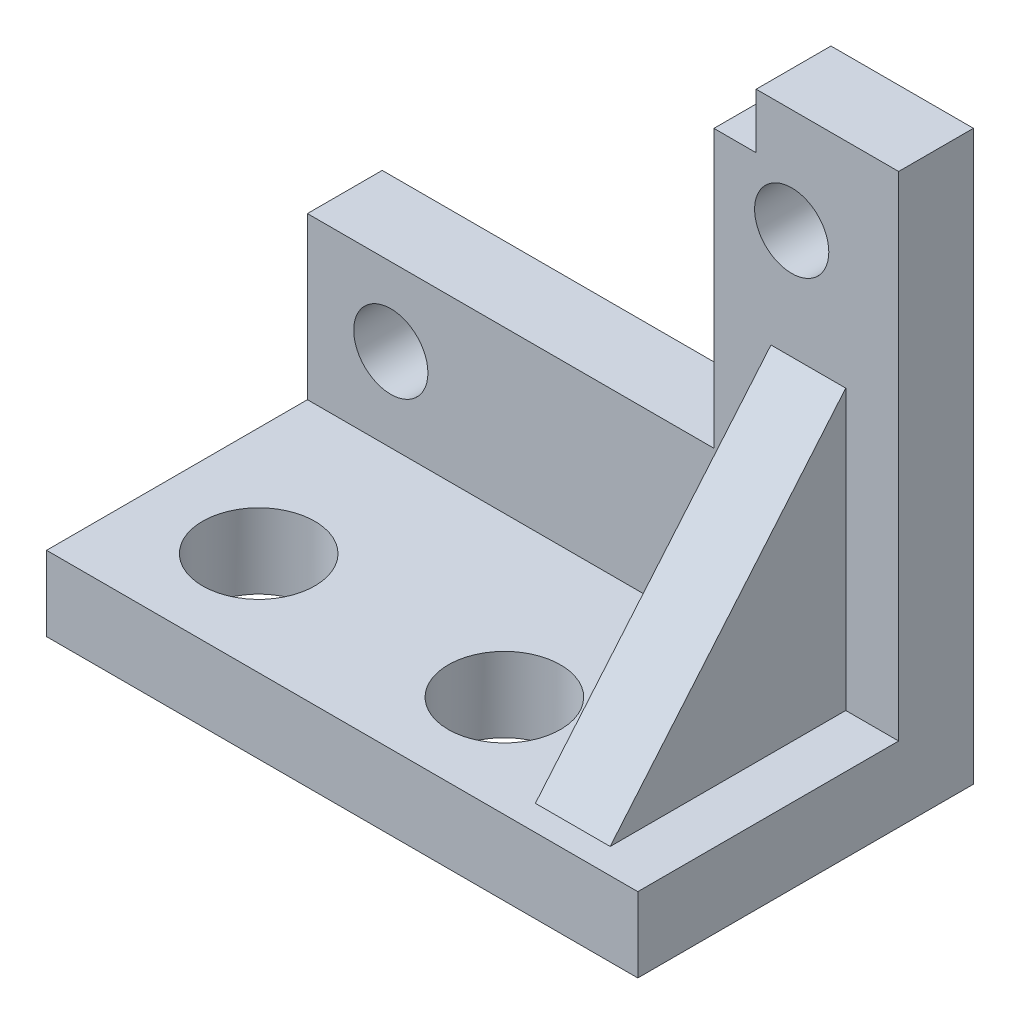
from build123d import *

# Parameters (mm, degrees)
SKETCH2_R           = 1.5748
BOSS_EXTRUDE1_DEPTH = 3.175
SKETCH5_W           = 24.098
SKETCH5_H           = 3.175
BOSS_EXTRUDE2_DEPTH = 19.05
SKETCH7_W           = 1
SKETCH7_H           = 6.842
BOSS_EXTRUDE3_DEPTH = 3.175
SKETCH8_W           = 1
SKETCH8_H           = 3.175
BOSS_EXTRUDE4_DEPTH = 19.05
SKETCH9_W           = 3.175
SKETCH9_H           = 11.85042952
BOSS_EXTRUDE5_DEPTH = 10
CUT_EXTRUDE1_DEPTH  = 33.332180825
SKETCH11_W          = 25.098
SKETCH11_H          = 4.801469349
SKETCH11_R          = 2.38125
CUT_EXTRUDE5_DEPTH  = 10


with BuildPart() as part:
    # Sketch2 → Boss-Extrude1 (new body)
    with BuildSketch(Plane.XY):
        Polygon((4.395213829, 10.321811953), (4.395213829, 7.827388121), (4.395213829, -1.438404904), (-11.860786171, -1.438404904), (-11.860786171, -8.280404904), (12.237213829, -8.280404904), (12.237213829, 12.658595096), (7.697213829, 12.658595096), (6.188170382, 12.658595096), (6.188170382, 10.321811953), align=None)
        with Locations((-9.320786171, -4.740404904)):
            Circle(SKETCH2_R, mode=Mode.SUBTRACT)
        with Locations((7.697213829, 8.213595096)):
            Circle(SKETCH2_R, mode=Mode.SUBTRACT)
    extrude(amount=BOSS_EXTRUDE1_DEPTH)

    # Sketch5 → Boss-Extrude2 (add)
    with BuildSketch(Plane(origin=(0, 0, 0), x_dir=(-1, 0, 0), z_dir=(0, 0, -1))):
        with Locations((-0.188213829, -9.867904904)):
            Rectangle(SKETCH5_W, SKETCH5_H)
    extrude(amount=-BOSS_EXTRUDE2_DEPTH)

    # Sketch7 → Boss-Extrude3 (add)
    with BuildSketch(Plane.XY.offset(3.175)):
        with Locations((-12.360786171, -4.859404904)):
            Rectangle(SKETCH7_W, SKETCH7_H)
    extrude(amount=-BOSS_EXTRUDE3_DEPTH)

    # Sketch8 → Boss-Extrude4 (add)
    with BuildSketch(Plane.XY.offset(19.05)):
        with Locations((-12.360786171, -9.867904904)):
            Rectangle(SKETCH8_W, SKETCH8_H)
    extrude(amount=-BOSS_EXTRUDE4_DEPTH)

    # Sketch9 → Boss-Extrude5 (add)
    with BuildSketch(Plane.XY.offset(3.175)):
        with Locations((8.404008836, -2.355190144)):
            Rectangle(SKETCH9_W, SKETCH9_H)
    extrude(amount=BOSS_EXTRUDE5_DEPTH)

    # Sketch10 → Cut-Extrude1 (cut, through all)
    with BuildSketch(Plane(origin=(9.991508836, 0, 0), x_dir=(0, 0, -1), z_dir=(1, 0, 0))):
        Polygon((-3.175, 3.570024616), (-13.175, -8.280404904), (-13.175, 3.570024616), align=None)
    extrude(amount=-CUT_EXTRUDE1_DEPTH, mode=Mode.SUBTRACT)

    # Sketch11 → Cut-Extrude5 (cut)
    with BuildSketch(Plane(origin=(0, -8.280404904, 0), x_dir=(1, 0, 0), z_dir=(0, 1, 0))):
        with Locations((-0.311786171, -16.649265326)):
            Rectangle(SKETCH11_W, SKETCH11_H)
        with Locations((-8.236677859, -9.867280651)):
            Circle(SKETCH11_R)
        with Locations((2.255867033, -9.930453782)):
            Circle(SKETCH11_R)
    extrude(amount=-CUT_EXTRUDE5_DEPTH, mode=Mode.SUBTRACT)


solid = part.part
